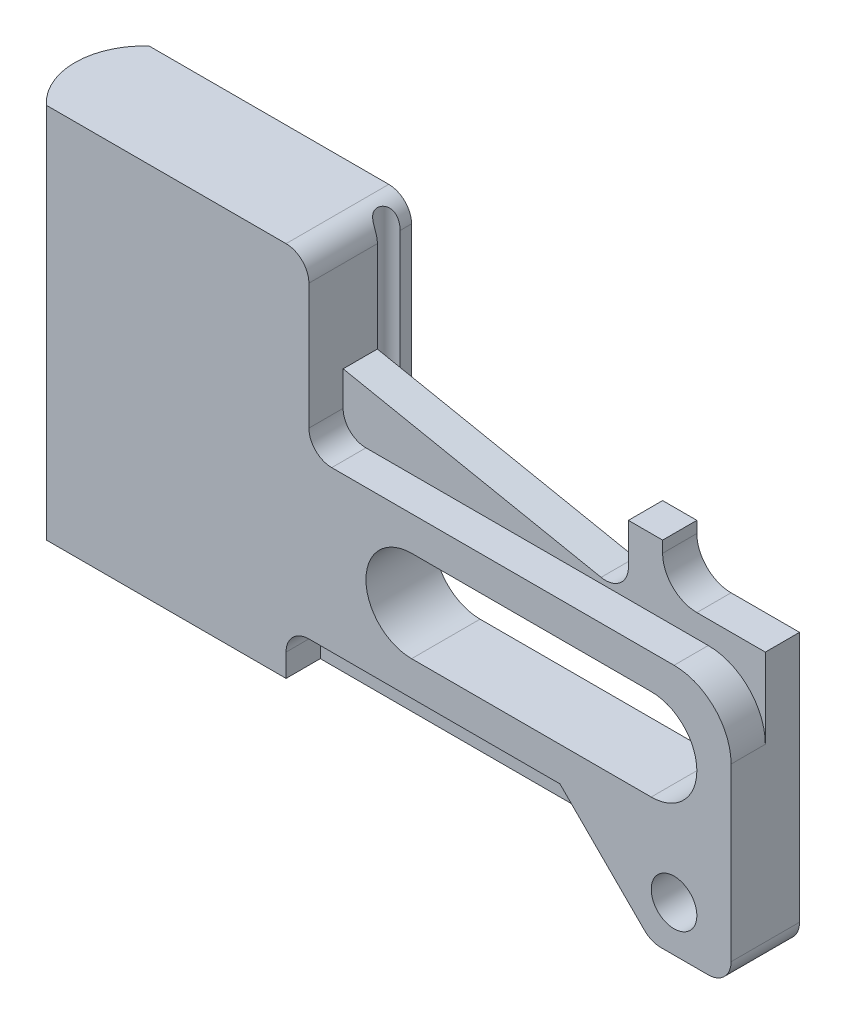
from build123d import *

# Parameters (mm, degrees)
EXTRUSION1_DEPTH        = 6
NERVURE1_REACH          = 70.739
ESQUISSE2_WALL_W        = 167.477270848
ESQUISSE2_WALL_H        = 3
ENL_V_MAT_EXTRU_1_DEPTH = 69.738635424
NERVURE2_REACH          = 70.739
ESQUISSE4_WALL_W        = 164.972368416
ESQUISSE4_WALL_H        = 3
CONG_1_R                = 2
CONG_3_R                = 5
NERVURE4_START          = -3
NERVURE4_DEPTH          = 3
CONG_4_R                = 3
CONG_5_R                = 2
ESQUISSE6_W             = 23
ESQUISSE6_H             = 33
EXTRUSION2_DEPTH        = 3
EXTRUSION3_DEPTH        = 33
CONG_7_R                = 2
ESQUISSE9_R             = 1
ENL_V_MAT_EXTRU_2_DEPTH = 71.746024717
ESQUISSE10_R            = 2
ENL_V_MAT_EXTRU_3_DEPTH = 70.065186747


# Read off the part's stored shape, not the designer's step: Nervure4
with BuildPart() as part:
    # Esquisse1 → Extrusion1 (new body)
    with BuildSketch(Plane.XY):
        Polygon((0, 0), (0, 33), (23, 33), (23, 18), (60, 18), (60, -4), (53, -4), (45, 4), (21, 4), (21, 0), align=None)
    extrude(amount=EXTRUSION1_DEPTH)

    # Esquisse2 wall → Nervure1 (add, up to next)
    with BuildSketch(Plane(origin=(35, 0, 0), x_dir=(1, 0, 0), z_dir=(0, -1, 0)), mode=Mode.PRIVATE) as nervure1_sk1:
        with Locations((0, 1.5)):
            Rectangle(ESQUISSE2_WALL_W, ESQUISSE2_WALL_H)
    nervure1_tool1 = extrude(nervure1_sk1.sketch, amount=-NERVURE1_REACH, mode=Mode.PRIVATE) - part.part
    add(nervure1_tool1.solids().sort_by_distance((35, 0, 0))[0])

    # Esquisse3 → Enlèv. mat.-Extru.1 (cut, through all)
    with BuildSketch(Plane.XY.offset(6)):
        with BuildLine():
            Line((32, 15), (53, 15))
            ThreePointArc((53, 15), (57, 11), (53, 7))
            Line((53, 7), (32, 7))
            ThreePointArc((32, 7), (28, 11), (32, 15))
        make_face()
    extrude(amount=-ENL_V_MAT_EXTRU_1_DEPTH, mode=Mode.SUBTRACT)

    # Esquisse4 wall → Nervure2 (add, up to next)
    with BuildSketch(Plane(origin=(35.5, 20.5, 0), x_dir=(0.980580675691, -0.196116135138, 0), z_dir=(-0.196116135138, -0.980580675691, 0)), mode=Mode.PRIVATE) as nervure2_sk1:
        with Locations((0, 1.5)):
            Rectangle(ESQUISSE4_WALL_W, ESQUISSE4_WALL_H)
    nervure2_tool1 = extrude(nervure2_sk1.sketch, amount=NERVURE2_REACH, mode=Mode.PRIVATE) - part.part
    add(nervure2_tool1.solids().sort_by_distance((35.5, 20.5, 0))[0])

    # Congé1
    cong_1_edges = [part.edges().sort_by_distance(p)[0] for p in [
        (23, 18, 4.5),
        (21, 4, 4.5),
    ]]
    fillet(cong_1_edges, radius=CONG_1_R)

    # Congé3
    cong_3_edges = [part.edges().sort_by_distance(p)[0] for p in [
        (60, 18, 3),
    ]]
    fillet(cong_3_edges, radius=CONG_3_R)

    # Nervure4 outline → Nervure4 (add)
    with BuildSketch(Plane(origin=(0, 0, 0), x_dir=(-1, 0, 0), z_dir=(0, 0, -1)).offset(NERVURE4_START)):
        with BuildLine():
            Line((-60, 20), (-60, 13))
            ThreePointArc((-60, 13), (-58.535533906, 16.535533906), (-55, 18))
            Line((-55, 18), (-48, 18))
            Line((-48, 18), (-48, 24))
            Line((-48, 24), (-51, 24))
            Line((-51, 24), (-51, 20))
            Line((-51, 20), (-60, 20))
        make_face()
    extrude(amount=NERVURE4_DEPTH)

    # Congé4
    cong_4_edges = [part.edges().sort_by_distance(p)[0] for p in [
        (51, 20, 1.5),
    ]]
    fillet(cong_4_edges, radius=CONG_4_R)

    # Congé5
    cong_5_edges = [part.edges().sort_by_distance(p)[0] for p in [
        (48, 18, 1.5),
    ]]
    fillet(cong_5_edges, radius=CONG_5_R)

    # Esquisse6 → Extrusion2 (add)
    with BuildSketch(Plane(origin=(0, 0, 0), x_dir=(-1, 0, 0), z_dir=(0, 0, -1))):
        with Locations((-11.5, 16.5)):
            Rectangle(ESQUISSE6_W, ESQUISSE6_H)
    extrude(amount=EXTRUSION2_DEPTH)

    # Esquisse8 → Extrusion3 (add)
    with BuildSketch(Plane(origin=(0, 33, 0), x_dir=(1, 0, 0), z_dir=(0, 1, 0))):
        with BuildLine():
            Line((0, 3), (0, -6))
            ThreePointArc((0, -6), (-2, -1.5), (0, 3))
        make_face()
    extrude(amount=-EXTRUSION3_DEPTH)

    # Congé7
    cong_7_edges = [part.edges().sort_by_distance(p)[0] for p in [
        (23, 33, 1.5),
        (60, -4, 3),
        (53, -4, 3),
    ]]
    fillet(cong_7_edges, radius=CONG_7_R)

    # Esquisse9 → Enlèv. mat.-Extru.2 (cut, through all)
    with BuildSketch(Plane(origin=(0, 33, 0), x_dir=(1, 0, 0), z_dir=(0, 1, 0))):
        with Locations((23, 1)):
            Circle(ESQUISSE9_R)
    extrude(amount=-ENL_V_MAT_EXTRU_2_DEPTH, mode=Mode.SUBTRACT)

    # Esquisse10 → Enlèv. mat.-Extru.3 (cut, through all)
    with BuildSketch(Plane.XY.offset(6)):
        with Locations((55, 0)):
            Circle(ESQUISSE10_R)
    extrude(amount=-ENL_V_MAT_EXTRU_3_DEPTH, mode=Mode.SUBTRACT)


solid = part.part
